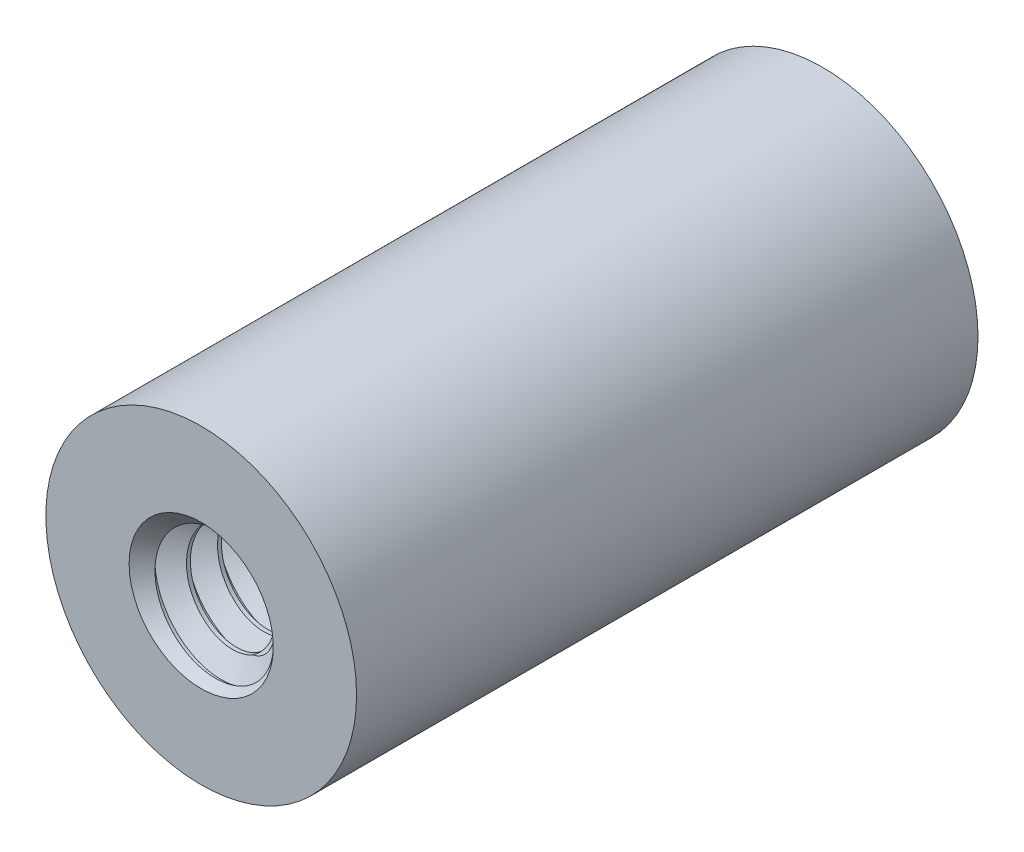
from build123d import *

# Parameters (mm, degrees)
EXTRUDE1_DEPTH      = 6.35
EXTRUDE1_DEPTH_BACK = 6.35
SKETCH1_R           = 3.175
SKETCH1_R_2         = 1.4224
SWEEP1_PITCH        = 0.635
SKETCH6_R           = 3.175
EXTRUDE2_DEPTH      = 15.070824366


with BuildPart() as part:
    # Sketch1 → Extrude1 (new, two sides: drawn at the far end of the back side and taken through both)
    with BuildSketch(Plane.XY.offset(-EXTRUDE1_DEPTH_BACK)):
        Circle(SKETCH1_R)
        Circle(SKETCH1_R_2, mode=Mode.SUBTRACT)
    extrude(amount=EXTRUDE1_DEPTH + EXTRUDE1_DEPTH_BACK)

    # Sweep1: the profile of Sketch12 profile screwed along a right-hand helix of 21 turns, 6 arcs to a turn; built about Z, then put on its axis
    sweep1_z = Axis((0, 0, 0), (0, 0, 1))
    sweep1_corners = [(1.4227, 0, -0.555798205), (1.4227, 0, 0.000173205), (1.009955401, 0, -0.238125), (1.009955401, 0, -0.3175)]
    with BuildLine(mode=Mode.PRIVATE) as sweep1_profile:
        Line(sweep1_corners[0], sweep1_corners[1])
        Line(sweep1_corners[1], sweep1_corners[2])
        Line(sweep1_corners[2], sweep1_corners[3])
        Line(sweep1_corners[3], sweep1_corners[0])
    sweep1_cap = Face(sweep1_profile.wire())
    sweep1_turn_angles = [0, 30, 60, 90, 120, 150, 180, 210, 240, 270, 300, 330, 360]
    sweep1_turn_weights = [1, 0.8660254037844387, 1, 0.8660254037844387, 1, 0.8660254037844387, 1, 0.8660254037844387, 1, 0.8660254037844387, 1, 0.8660254037844387, 1]
    sweep1_turn_rails = [Edge.make_bspline([Vector(p[0], p[1], 0).rotate(sweep1_z, sweep1_turn_angles[k]) / sweep1_turn_weights[k] + Vector(0, 0, p[2] + SWEEP1_PITCH * sweep1_turn_angles[k] / 360) for k in range(13)], [0, 0, 0, 1, 1, 2, 2, 3, 3, 4, 4, 5, 5, 6, 6, 6], 2, sweep1_turn_weights) for p in sweep1_corners]
    sweep1_turn_sides = [Face.make_surface_from_curves(sweep1_turn_rails[p[0]], sweep1_turn_rails[p[1]]) for p in [(0, 1), (1, 2), (2, 3), (3, 0)]]
    sweep1 = Plane(origin=(0, 0, -6.35), x_dir=(0, 1, 0), z_dir=(0, 0, 1)) * Solid(Shell([*[p.moved(Location((0, 0, SWEEP1_PITCH * i))) for i in range(21) for p in sweep1_turn_sides], sweep1_cap, sweep1_cap.rotate(sweep1_z, 7560).moved(Location((0, 0, SWEEP1_PITCH * 7560 / 360)))]))
    add(sweep1)

    # Sketch6 → Extrude2 (cut, through all)
    with BuildSketch(Plane(origin=(0, 0, -6.35), x_dir=(-1, 0, 0), z_dir=(0, 0, -1))):
        with Locations(Location((0, 0, 0), (0, 0, 180))):
            Circle(SKETCH6_R)
    extrude2 = extrude(amount=EXTRUDE2_DEPTH, mode=Mode.SUBTRACT)

    # Extrude3 cone 1 section (through the dimple's axis) → Extrude3 (revolve, cut)
    with BuildSketch(Plane(origin=(0, 0, -6.35), x_dir=(0, 1, 0), z_dir=(1, 0, 0))):
        Polygon((0, 0), (1.4732, 0), (0, 1.579813584), align=None)
    extrude3 = revolve(axis=Axis((0, 0, -6.35), (0, 0, 1)), mode=Mode.SUBTRACT)

    # Mirror1: Extrude2, Extrude3 across plane
    add(extrude2.mirror(Plane.XY), mode=Mode.SUBTRACT)
    add(extrude3.mirror(Plane.XY), mode=Mode.SUBTRACT)


solid = part.part
